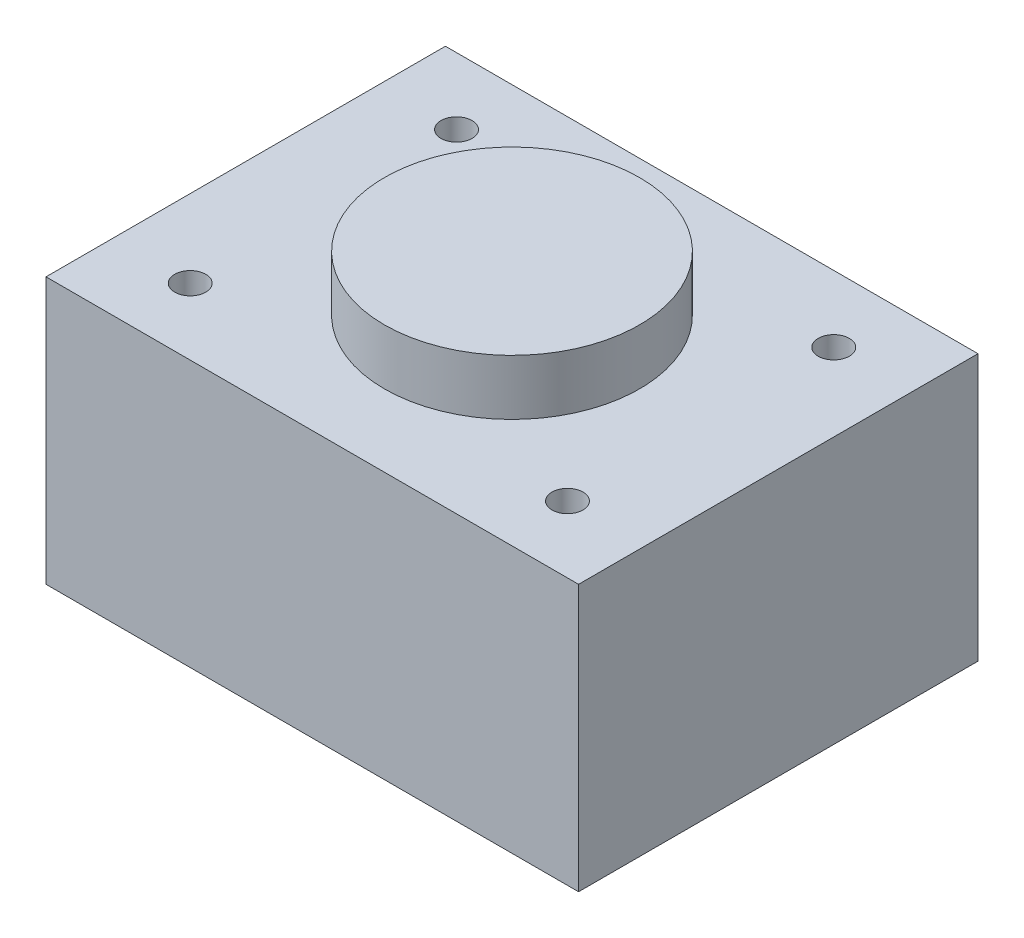
from build123d import *

# Parameters (mm, degrees)
F_01_HOUSING_PROFILE_W        = 240
F_01_HOUSING_PROFILE_H        = 180
F_01_HOUSING_PROFILE_R        = 7
F_01_HOUSING_BLOCK_DEPTH      = 120
F_02_FACE_BOSS_PROFILE_R      = 57.5
F_02_FACE_LOCATING_BOSS_DEPTH = 145


with BuildPart() as part:
    # 01_Housing_Profile → 01_Housing_Block (new body)
    with BuildSketch(Plane(origin=(0, 0, 0), x_dir=(1, 0, 0), z_dir=(0, 1, 0))):
        Rectangle(F_01_HOUSING_PROFILE_W, F_01_HOUSING_PROFILE_H)
        with Locations((-85, -60)):
            Circle(F_01_HOUSING_PROFILE_R, mode=Mode.SUBTRACT)
        with Locations((85, -60)):
            Circle(F_01_HOUSING_PROFILE_R, mode=Mode.SUBTRACT)
        with Locations((-85, 60)):
            Circle(F_01_HOUSING_PROFILE_R, mode=Mode.SUBTRACT)
        with Locations((85, 60)):
            Circle(F_01_HOUSING_PROFILE_R, mode=Mode.SUBTRACT)
    extrude(amount=F_01_HOUSING_BLOCK_DEPTH)

    # 02_Face_Boss_Profile → 02_Face_Locating_Boss (add)
    with BuildSketch(Plane(origin=(0, 0, 0), x_dir=(1, 0, 0), z_dir=(0, 1, 0))):
        Circle(F_02_FACE_BOSS_PROFILE_R)
    extrude(amount=F_02_FACE_LOCATING_BOSS_DEPTH)


solid = part.part
